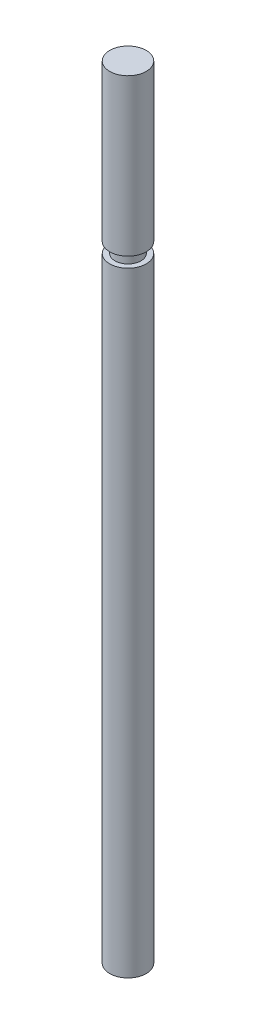
from build123d import *

# Parameters (mm, degrees)
SKETCH1_R           = 1.75
BOSS_EXTRUDE1_DEPTH = 75
CUT_EXTRUDE1_START  = -1
SKETCH2_R           = 1.75
SKETCH2_R_2         = 1.25
CUT_EXTRUDE1_DEPTH  = 1


with BuildPart() as part:
    # Sketch1 → Boss-Extrude1 (new body)
    with BuildSketch(Plane(origin=(0, 0, 0), x_dir=(1, 0, 0), z_dir=(0, 1, 0))):
        Circle(SKETCH1_R)
    extrude(amount=BOSS_EXTRUDE1_DEPTH)

    # Sketch2 → Cut-Extrude1 (cut)
    with BuildSketch(Plane(origin=(0, 60, 0), x_dir=(1, 0, 0), z_dir=(0, 1, 0)).offset(CUT_EXTRUDE1_START)):
        Circle(SKETCH2_R)
        Circle(SKETCH2_R_2, mode=Mode.SUBTRACT)
    extrude(amount=CUT_EXTRUDE1_DEPTH, mode=Mode.SUBTRACT)


solid = part.part
